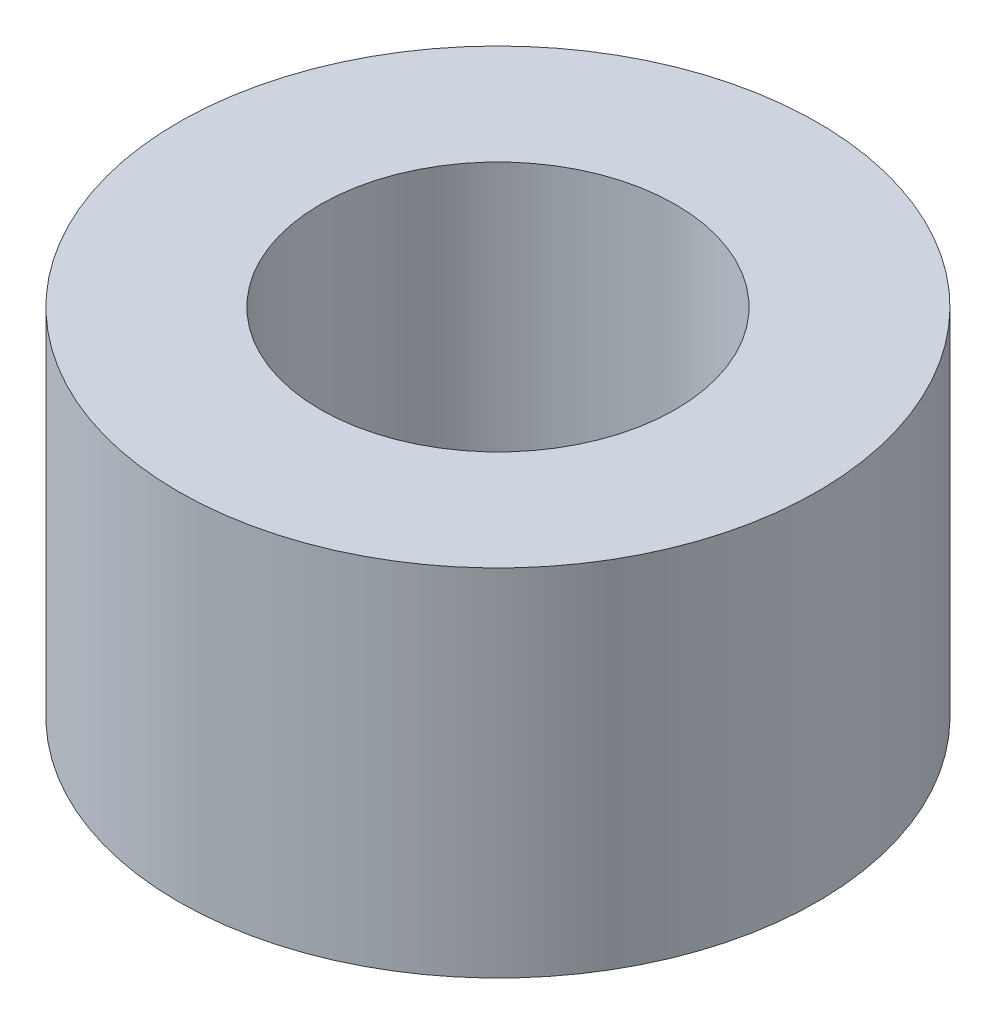
from build123d import *

# Parameters (mm, degrees)
SKETCH1_W = 2
SKETCH1_H = 5


with BuildPart() as part:
    # Sketch1 → Revolve1 (revolve)
    with BuildSketch(Plane.XY):
        with Locations((-3.5, 0)):
            Rectangle(SKETCH1_W, SKETCH1_H)
    revolve(axis=Axis((0, 9.409090909, 0), (0, -1, 0)))


solid = part.part
